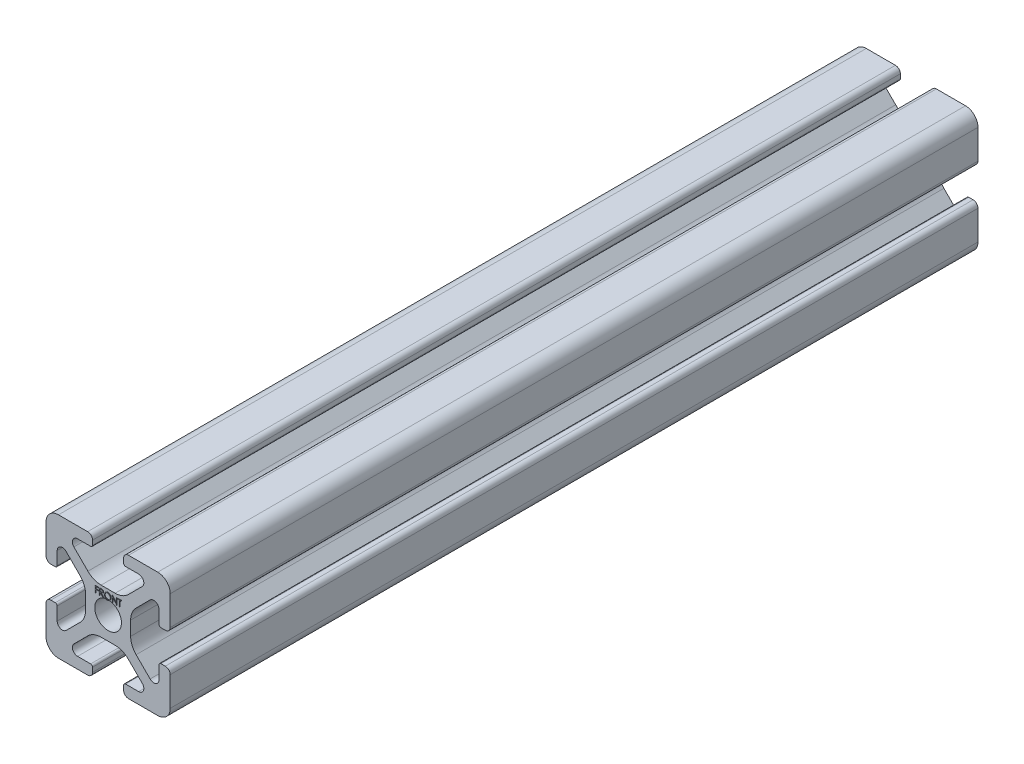
from build123d import *

# Parameters (mm, degrees)
SKETCH1_R           = 2.1463
BOSS_EXTRUDE1_DEPTH = 130
WRAP1_DEPTH         = 0.1


# Read off the part's stored shape, not the designer's step: Wrap1
with BuildPart() as part:
    # Sketch1 → Boss-Extrude1 (new body)
    with BuildSketch(Plane.XY):
        with BuildLine():
            Line((-9.9949, 7.9883), (-9.9949, 3.2893))
            ThreePointArc((-9.9949, 3.2893), (-9.76427588, 2.73252412), (-9.2075, 2.5019))
            Line((-9.2075, 2.5019), (-8.4963, 2.5019))
            ThreePointArc((-8.4963, 2.5019), (-8.280773853, 2.591173853), (-8.1915, 2.8067))
            Line((-8.1915, 2.8067), (-8.1915, 4.9149))
            ThreePointArc((-8.1915, 4.9149), (-7.674065253, 5.689295824), (-6.760603096, 5.507596904))
            Line((-6.760603096, 5.507596904), (-4.505765747, 3.252759555))
            ThreePointArc((-4.505765747, 3.252759555), (-3.856054457, 2.280397894), (-3.627906192, 1.133419111))
            Line((-3.627906192, 1.133419111), (-3.627906192, -1.133419111))
            ThreePointArc((-3.627906192, -1.133419111), (-3.856054457, -2.280397894), (-4.505765747, -3.252759555))
            Line((-4.505765747, -3.252759555), (-6.760603096, -5.507596904))
            ThreePointArc((-6.760603096, -5.507596904), (-7.674065253, -5.689295824), (-8.1915, -4.9149))
            Line((-8.1915, -4.9149), (-8.1915, -2.8067))
            ThreePointArc((-8.1915, -2.8067), (-8.280773853, -2.591173853), (-8.4963, -2.5019))
            Line((-8.4963, -2.5019), (-9.2075, -2.5019))
            ThreePointArc((-9.2075, -2.5019), (-9.76427588, -2.73252412), (-9.9949, -3.2893))
            Line((-9.9949, -3.2893), (-9.9949, -7.9883))
            ThreePointArc((-9.9949, -7.9883), (-9.407180467, -9.407180467), (-7.9883, -9.9949))
            Line((-7.9883, -9.9949), (-3.2893, -9.9949))
            ThreePointArc((-3.2893, -9.9949), (-2.73252412, -9.76427588), (-2.5019, -9.2075))
            Line((-2.5019, -9.2075), (-2.5019, -8.4963))
            ThreePointArc((-2.5019, -8.4963), (-2.591173853, -8.280773853), (-2.8067, -8.1915))
            Line((-2.8067, -8.1915), (-4.9149, -8.1915))
            ThreePointArc((-4.9149, -8.1915), (-5.689295824, -7.674065253), (-5.507596904, -6.760603096))
            Line((-5.507596904, -6.760603096), (-3.252759555, -4.505765747))
            ThreePointArc((-3.252759555, -4.505765747), (-2.280397894, -3.856054457), (-1.133419111, -3.627906192))
            Line((-1.133419111, -3.627906192), (1.133419111, -3.627906192))
            ThreePointArc((1.133419111, -3.627906192), (2.280397894, -3.856054457), (3.252759555, -4.505765747))
            Line((3.252759555, -4.505765747), (5.507596904, -6.760603096))
            ThreePointArc((5.507596904, -6.760603096), (5.689295824, -7.674065253), (4.9149, -8.1915))
            Line((4.9149, -8.1915), (2.8067, -8.1915))
            ThreePointArc((2.8067, -8.1915), (2.591173853, -8.280773853), (2.5019, -8.4963))
            Line((2.5019, -8.4963), (2.5019, -9.2075))
            ThreePointArc((2.5019, -9.2075), (2.73252412, -9.76427588), (3.2893, -9.9949))
            Line((3.2893, -9.9949), (7.9883, -9.9949))
            ThreePointArc((7.9883, -9.9949), (9.407180467, -9.407180467), (9.9949, -7.9883))
            Line((9.9949, -7.9883), (9.9949, -3.2893))
            ThreePointArc((9.9949, -3.2893), (9.76427588, -2.73252412), (9.2075, -2.5019))
            Line((9.2075, -2.5019), (8.4963, -2.5019))
            ThreePointArc((8.4963, -2.5019), (8.280773853, -2.591173853), (8.1915, -2.8067))
            Line((8.1915, -2.8067), (8.1915, -4.9149))
            ThreePointArc((8.1915, -4.9149), (7.674065253, -5.689295824), (6.760603096, -5.507596904))
            Line((6.760603096, -5.507596904), (4.505765747, -3.252759555))
            ThreePointArc((4.505765747, -3.252759555), (3.856054457, -2.280397894), (3.627906192, -1.133419111))
            Line((3.627906192, -1.133419111), (3.627906192, 1.133419111))
            ThreePointArc((3.627906192, 1.133419111), (3.856054457, 2.280397894), (4.505765747, 3.252759555))
            Line((4.505765747, 3.252759555), (6.760603096, 5.507596904))
            ThreePointArc((6.760603096, 5.507596904), (7.674065253, 5.689295824), (8.1915, 4.9149))
            Line((8.1915, 4.9149), (8.1915, 2.8067))
            ThreePointArc((8.1915, 2.8067), (8.280773853, 2.591173853), (8.4963, 2.5019))
            Line((8.4963, 2.5019), (9.2075, 2.5019))
            ThreePointArc((9.2075, 2.5019), (9.76427588, 2.73252412), (9.9949, 3.2893))
            Line((9.9949, 3.2893), (9.9949, 7.9883))
            ThreePointArc((9.9949, 7.9883), (9.407180467, 9.407180467), (7.9883, 9.9949))
            Line((7.9883, 9.9949), (3.2893, 9.9949))
            ThreePointArc((3.2893, 9.9949), (2.73252412, 9.76427588), (2.5019, 9.2075))
            Line((2.5019, 9.2075), (2.5019, 8.4963))
            ThreePointArc((2.5019, 8.4963), (2.591173853, 8.280773853), (2.8067, 8.1915))
            Line((2.8067, 8.1915), (4.9149, 8.1915))
            ThreePointArc((4.9149, 8.1915), (5.689295824, 7.674065253), (5.507596904, 6.760603096))
            Line((5.507596904, 6.760603096), (3.252759555, 4.505765747))
            ThreePointArc((3.252759555, 4.505765747), (2.280397894, 3.856054457), (1.133419111, 3.627906192))
            Line((1.133419111, 3.627906192), (-1.133419111, 3.627906192))
            ThreePointArc((-1.133419111, 3.627906192), (-2.280397894, 3.856054457), (-3.252759555, 4.505765747))
            Line((-3.252759555, 4.505765747), (-5.507596904, 6.760603096))
            ThreePointArc((-5.507596904, 6.760603096), (-5.689295824, 7.674065253), (-4.9149, 8.1915))
            Line((-4.9149, 8.1915), (-2.8067, 8.1915))
            ThreePointArc((-2.8067, 8.1915), (-2.591173853, 8.280773853), (-2.5019, 8.4963))
            Line((-2.5019, 8.4963), (-2.5019, 9.2075))
            ThreePointArc((-2.5019, 9.2075), (-2.73252412, 9.76427588), (-3.2893, 9.9949))
            Line((-3.2893, 9.9949), (-7.9883, 9.9949))
            ThreePointArc((-7.9883, 9.9949), (-9.407180467, 9.407180467), (-9.9949, 7.9883))
        make_face()
        Circle(SKETCH1_R, mode=Mode.SUBTRACT)
    extrude(amount=BOSS_EXTRUDE1_DEPTH)

    # Wrap1 outline → Wrap1 (add)
    # profile 1 of 5: a face of its own
    with BuildSketch(Plane.XY.offset(130)):
        with BuildLine():
            add(Edge.make_bspline(
                [(-1.158854167, 3.1463), (-1.145499559, 3.146255547), (-1.119857232, 3.146170192), (-1.083122011, 3.14569426), (-1.049742841, 3.144330158), (-1.019737172, 3.143156277), (-0.993105557, 3.141015722), (-0.969766331, 3.138969823), (-0.949826989, 3.136291634), (-0.937756745, 3.133804371), (-0.932291667, 3.132678205)],
                knots=[0, 0, 0, 0, 0.176257755, 0.338434414, 0.484822051, 0.617157578, 0.734698361, 0.837385184, 0.926372421, 1, 1, 1, 1], degree=3))
            Line((-1.158854167, 3.1463), (-1.358974359, 3.1463))
            Line((-1.358974359, 3.1463), (-1.358974359, 2.1463))
            Line((-1.358974359, 2.1463), (-1.269230769, 2.1463))
            Line((-1.269230769, 2.1463), (-1.269230769, 2.607838462))
            Line((-1.269230769, 2.607838462), (-1.196314103, 2.607838462))
            Line((-1.196314103, 2.607838462), (-0.828926282, 2.1463))
            Line((-0.828926282, 2.1463), (-0.717948718, 2.1463))
            Line((-0.717948718, 2.1463), (-1.085336538, 2.607838462))
            add(Edge.make_bspline(
                [(-0.730769231, 2.878872115), (-0.731188945, 2.8655478), (-0.732007915, 2.839548609), (-0.739643659, 2.801816929), (-0.752151236, 2.766619982), (-0.769386461, 2.734002085), (-0.791334883, 2.704599043), (-0.817713395, 2.678773199), (-0.848536712, 2.657161795), (-0.877230802, 2.64217528), (-0.902577717, 2.632577306), (-0.923444377, 2.625824061), (-0.946206371, 2.620606356), (-0.970645609, 2.615932033), (-0.996863797, 2.612402977), (-1.024798094, 2.609818236), (-1.054468423, 2.608202794), (-1.074851014, 2.607962221), (-1.085336538, 2.607838462)],
                knots=[0, 0, 0, 0, 0.078780236, 0.153720644, 0.22671353, 0.299191166, 0.371189997, 0.443006414, 0.516689173, 0.593217217, 0.633872918, 0.676989142, 0.722899506, 0.771958611, 0.824211323, 0.879378651, 0.937948119, 1, 1, 1, 1], degree=3))
            add(Edge.make_bspline(
                [(-0.932291667, 3.132678205), (-0.924975488, 3.130870558), (-0.910499206, 3.127293825), (-0.88965633, 3.119733939), (-0.869795094, 3.110985475), (-0.850998002, 3.100710127), (-0.833359204, 3.088831618), (-0.81669683, 3.075555012), (-0.800935269, 3.060952953), (-0.786711946, 3.044657284), (-0.773300788, 3.027561138), (-0.761989752, 3.009074351), (-0.752239329, 2.989742486), (-0.744476324, 2.969368938), (-0.738225475, 2.948151289), (-0.733817978, 2.925897347), (-0.731174781, 2.902708497), (-0.73090568, 2.886891951), (-0.730769231, 2.878872115)],
                knots=[0, 0, 0, 0, 0.064216843, 0.127063766, 0.188744538, 0.249132103, 0.309452533, 0.369826676, 0.430650142, 0.492351932, 0.554072106, 0.615689784, 0.676797703, 0.738439048, 0.80131691, 0.865184512, 0.931641324, 1, 1, 1, 1], degree=3))
        make_face()
        with BuildLine():
            add(Edge.make_bspline(
                [(-1.086137821, 2.709000321), (-1.077589238, 2.708996539), (-1.06101965, 2.708989208), (-1.037048032, 2.710130287), (-1.014728, 2.711428378), (-0.994144928, 2.713413905), (-0.975289621, 2.715972783), (-0.958171502, 2.719173636), (-0.94276263, 2.722902796), (-0.924791619, 2.728674689), (-0.904724039, 2.737819266), (-0.882915051, 2.751123694), (-0.864342954, 2.767857728), (-0.848652136, 2.786993002), (-0.836043727, 2.80803193), (-0.827154569, 2.830722321), (-0.821513871, 2.854491349), (-0.820848572, 2.870827951), (-0.820512821, 2.879072436)],
                knots=[0, 0, 0, 0, 0.07166815, 0.138913286, 0.20118457, 0.259124428, 0.312255041, 0.36068151, 0.405086143, 0.445101659, 0.51877778, 0.589461579, 0.658462242, 0.727283218, 0.796322487, 0.863174893, 0.930949381, 1, 1, 1, 1], degree=3))
            Line((-1.086137821, 2.709000321), (-1.269230769, 2.710402564))
            Line((-1.269230769, 2.710402564), (-1.269230769, 3.043735897))
            Line((-1.269230769, 3.043735897), (-1.081730769, 3.043735897))
            add(Edge.make_bspline(
                [(-0.820512821, 2.879072436), (-0.820856284, 2.887114314), (-0.821536902, 2.903050382), (-0.827093693, 2.926380642), (-0.836490659, 2.948399771), (-0.849154156, 2.969018195), (-0.864582486, 2.98773412), (-0.88267329, 3.003747592), (-0.902931917, 3.016961725), (-0.921866545, 3.025405834), (-0.938790606, 3.030582935), (-0.953484794, 3.034226124), (-0.970088074, 3.037153115), (-0.988681062, 3.039498276), (-1.009184385, 3.041513974), (-1.031701714, 3.042871625), (-1.056083651, 3.043675586), (-1.072982774, 3.043715326), (-1.081730769, 3.043735897)],
                knots=[0, 0, 0, 0, 0.068814296, 0.136364825, 0.204019354, 0.273063739, 0.34291332, 0.410965444, 0.479168767, 0.549308007, 0.587651576, 0.630646669, 0.678878786, 0.731934299, 0.791111423, 0.85528319, 0.925085939, 1, 1, 1, 1], degree=3))
        make_face(mode=Mode.SUBTRACT)
    # profile 2 of 5: a face of its own
    with BuildSketch(Plane.XY.offset(130)):
        with BuildLine():
            add(Edge.make_bspline(
                [(0.487179487, 2.646700641), (0.486736649, 2.628712799), (0.485863765, 2.593256679), (0.478386971, 2.541215695), (0.466660971, 2.491189782), (0.449919181, 2.443262452), (0.428426187, 2.397383148), (0.401953281, 2.35367259), (0.370770078, 2.312116448), (0.335282406, 2.273169972), (0.296596394, 2.237456409), (0.255102032, 2.20633673), (0.211732512, 2.179558409), (0.166776254, 2.15858654), (0.136050476, 2.147480684), (0.120869489, 2.142893898)],
                knots=[0, 0, 0, 0, 0.065226504, 0.128568996, 0.190320378, 0.251377989, 0.312387528, 0.373788704, 0.43643116, 0.500566755, 0.564686795, 0.627135518, 0.688455409, 0.749245746, 0.806772651, 0.806772651, 0.806772651, 0.806772651], degree=3))
            add(Edge.make_bspline(
                [(-0.044871795, 3.171941026), (-0.026355193, 3.171472032), (0.01001294, 3.170550888), (0.063462911, 3.163499716), (0.114490081, 3.151301033), (0.163510121, 3.135054467), (0.209936685, 3.113381785), (0.254119226, 3.087186028), (0.295952619, 3.056192755), (0.334873013, 3.020641547), (0.370489285, 2.98196056), (0.40186811, 2.940681157), (0.428165908, 2.897052928), (0.449761847, 2.851206976), (0.466704307, 2.803246985), (0.478395462, 2.75291727), (0.485863505, 2.70054393), (0.486736584, 2.664821969), (0.487179487, 2.646700641)],
                knots=[0, 0, 0, 0, 0.066570035, 0.130749041, 0.1934128, 0.254989399, 0.316113556, 0.377261758, 0.439400784, 0.502970589, 0.566524976, 0.628231103, 0.689090611, 0.749344669, 0.810169593, 0.871609824, 0.934869184, 1, 1, 1, 1], degree=3))
            add(Edge.make_bspline(
                [(-0.564102564, 2.641892949), (-0.563949811, 2.653787997), (-0.563646232, 2.677428032), (-0.559991463, 2.712532775), (-0.55468812, 2.747072963), (-0.547087573, 2.780950377), (-0.537147097, 2.814082087), (-0.525417946, 2.84669659), (-0.511092276, 2.878463369), (-0.494897805, 2.909532909), (-0.476823003, 2.939420882), (-0.456858503, 2.967672192), (-0.435705541, 2.994523905), (-0.412516, 3.019280192), (-0.388054158, 3.042661237), (-0.361923193, 3.064307727), (-0.334282552, 3.084414856), (-0.3050133, 3.102534953), (-0.27483665, 3.118923278), (-0.243729, 3.132986664), (-0.212112836, 3.145056967), (-0.17984008, 3.15484006), (-0.146996431, 3.162563499), (-0.113510206, 3.167822743), (-0.079408085, 3.171486833), (-0.056433422, 3.171788977), (-0.044871795, 3.171941026)],
                knots=[0, 0, 0, 0, 0.043208986, 0.085872872, 0.128120007, 0.170151964, 0.211917621, 0.253753003, 0.296006409, 0.338443357, 0.381015368, 0.422820479, 0.464089056, 0.505125849, 0.545974971, 0.586985211, 0.628338592, 0.670083802, 0.711991602, 0.753039155, 0.794049395, 0.834885543, 0.875498313, 0.9165473, 0.958003779, 1, 1, 1, 1], degree=3))
            add(Edge.make_bspline(
                [(-0.181004049, 2.138654068), (-0.185187206, 2.139746153), (-0.205650494, 2.145368804), (-0.241653164, 2.157869199), (-0.287608859, 2.179474122), (-0.331463168, 2.20581823), (-0.373040067, 2.237077413), (-0.411994852, 2.272553578), (-0.44763748, 2.311174021), (-0.478711587, 2.352555237), (-0.50506162, 2.395885367), (-0.526594, 2.44128466), (-0.543640989, 2.488533643), (-0.555270937, 2.537947494), (-0.562795495, 2.589244496), (-0.563662594, 2.624171038), (-0.564102564, 2.641892949)],
                knots=[0.176365138, 0.176365138, 0.176365138, 0.176365138, 0.192071954, 0.253459424, 0.314569588, 0.376279881, 0.439025654, 0.503267029, 0.567492823, 0.629704796, 0.690999649, 0.751451651, 0.812004364, 0.873149681, 0.935635484, 1, 1, 1, 1], degree=3))
            ThreePointArc((-0.181004049, 2.138654068), (-0.030141921, 2.146088338), (0.120869489, 2.142893898))
        make_face()
        with BuildLine():
            add(Edge.make_bspline(
                [(-0.474358974, 2.64229359), (-0.473994728, 2.627847241), (-0.473278143, 2.599426804), (-0.467004552, 2.557778763), (-0.45734113, 2.517753538), (-0.443096168, 2.479570135), (-0.425281707, 2.44290034), (-0.403274024, 2.408069453), (-0.3772, 2.37506806), (-0.347581849, 2.344126555), (-0.315203933, 2.315884897), (-0.280823153, 2.291095351), (-0.244807837, 2.270120994), (-0.207064064, 2.253033831), (-0.167793339, 2.239493906), (-0.12674261, 2.230214297), (-0.084185336, 2.224107024), (-0.055176577, 2.223520522), (-0.040464744, 2.223223077)],
                knots=[0, 0, 0, 0, 0.064503999, 0.126899322, 0.18774654, 0.248149733, 0.308586065, 0.369583005, 0.431826965, 0.496179723, 0.560667855, 0.623504455, 0.685260411, 0.746536822, 0.808327352, 0.870486188, 0.934316883, 1, 1, 1, 1], degree=3))
            add(Edge.make_bspline(
                [(-0.040464744, 3.069376923), (-0.049954639, 3.06926124), (-0.068843705, 3.06903098), (-0.096925002, 3.065997919), (-0.124636983, 3.061675093), (-0.151985372, 3.055508944), (-0.17885574, 3.047107786), (-0.205498552, 3.037438956), (-0.231670853, 3.025661501), (-0.257286241, 3.012355014), (-0.28211912, 2.997626751), (-0.30555132, 2.981349103), (-0.327643504, 2.963903802), (-0.34834158, 2.945250134), (-0.367584772, 2.925293105), (-0.38575183, 2.904335266), (-0.402114567, 2.881777583), (-0.417110447, 2.858231753), (-0.430529829, 2.833728444), (-0.442462788, 2.808525626), (-0.452223933, 2.782417715), (-0.460184612, 2.755687956), (-0.466784558, 2.728378682), (-0.470965679, 2.700282725), (-0.474032068, 2.671541265), (-0.474249167, 2.652117878), (-0.474358974, 2.64229359)],
                knots=[0, 0, 0, 0, 0.042023329, 0.083644911, 0.124983795, 0.166247461, 0.207701556, 0.249631071, 0.29174177, 0.334742875, 0.377460169, 0.419556319, 0.461044176, 0.502096284, 0.542890714, 0.583800819, 0.624863583, 0.666224689, 0.707399186, 0.748556678, 0.789654591, 0.830739726, 0.872070142, 0.913993395, 0.95649813, 1, 1, 1, 1], degree=3))
            add(Edge.make_bspline(
                [(0.397435897, 2.646900962), (0.397321294, 2.656591106), (0.397093956, 2.675813291), (0.394081821, 2.704230668), (0.38976728, 2.7320173), (0.383549364, 2.759064101), (0.375535034, 2.785377965), (0.36565294, 2.810934179), (0.353999997, 2.835827949), (0.340626219, 2.859997748), (0.325593126, 2.88319053), (0.3091662, 2.905362648), (0.291061814, 2.926097717), (0.271797236, 2.94590763), (0.250891269, 2.964369884), (0.228438613, 2.981490604), (0.204711848, 2.997682968), (0.179589781, 3.012290271), (0.153662937, 3.025780052), (0.127058949, 3.037337482), (0.100079206, 3.047158087), (0.072792317, 3.055534363), (0.044968609, 3.061650943), (0.016796086, 3.066001814), (-0.011686273, 3.069029925), (-0.030841479, 3.06926089), (-0.040464744, 3.069376923)],
                knots=[0, 0, 0, 0, 0.042915082, 0.085129971, 0.126473319, 0.167453038, 0.207976333, 0.248249378, 0.288749987, 0.329669857, 0.370537287, 0.411128564, 0.451818913, 0.492405877, 0.533485862, 0.575263062, 0.617440613, 0.660671688, 0.703940204, 0.746867522, 0.7890793, 0.831104042, 0.87323799, 0.91516577, 0.957380658, 1, 1, 1, 1], degree=3))
            add(Edge.make_bspline(
                [(-0.040464744, 2.223223077), (-0.030576315, 2.223358935), (-0.01096459, 2.223628383), (0.018205559, 2.226342291), (0.046850191, 2.230694254), (0.074929128, 2.236960155), (0.102410503, 2.244802214), (0.129409018, 2.254118708), (0.155637101, 2.265741909), (0.181425626, 2.278584181), (0.206110267, 2.293224226), (0.229674705, 2.308949412), (0.251524985, 2.326369017), (0.272207576, 2.344745535), (0.291529773, 2.364449492), (0.309360912, 2.385455269), (0.325640949, 2.407895457), (0.340631134, 2.431405573), (0.354003495, 2.455975931), (0.365654666, 2.481270125), (0.375539271, 2.50722587), (0.383518843, 2.533880605), (0.389771832, 2.561183705), (0.394080381, 2.589171727), (0.397094221, 2.617788682), (0.397321385, 2.637144069), (0.397435897, 2.646900962)],
                knots=[0, 0, 0, 0, 0.043633218, 0.086537777, 0.129177336, 0.171436324, 0.213415895, 0.255265955, 0.297369481, 0.339940748, 0.382347459, 0.423952947, 0.464871163, 0.505572294, 0.546002577, 0.586567975, 0.627064799, 0.668270684, 0.709549225, 0.750428154, 0.791096194, 0.832027145, 0.873135955, 0.914610764, 0.956955986, 1, 1, 1, 1], degree=3))
        make_face(mode=Mode.SUBTRACT)
    # profile 3 of 5: a face of its own
    with BuildSketch(Plane.XY.offset(130)):
        Polygon((-1.935897436, 3.043735897), (-1.538461538, 3.043735897), (-1.538461538, 3.1463), (-2.025641026, 3.1463), (-2.025641026, 2.1463), (-1.935897436, 2.1463), (-1.935897436, 2.633479487), (-1.538461538, 2.633479487), (-1.538461538, 2.73604359), (-1.935897436, 2.73604359), align=None)
    # profile 4 of 5: a face of its own
    with BuildSketch(Plane.XY.offset(130)):
        Polygon((1.91025641, 2.1463), (1.91025641, 3.043735897), (2.128205128, 3.043735897), (2.128205128, 3.1463), (1.602564103, 3.1463), (1.602564103, 3.043735897), (1.820512821, 3.043735897), (1.820512821, 2.1463), align=None)
    # profile 5 of 5: a face of its own
    with BuildSketch(Plane.XY.offset(130)):
        Polygon((0.782051282, 2.93155641), (1.441105769, 2.1463), (1.461538462, 2.1463), (1.461538462, 3.1463), (1.371794872, 3.1463), (1.371794872, 2.359240705), (0.711137821, 3.1463), (0.692307692, 3.1463), (0.692307692, 2.1463), (0.782051282, 2.1463), align=None)
    extrude(amount=WRAP1_DEPTH)


solid = part.part
